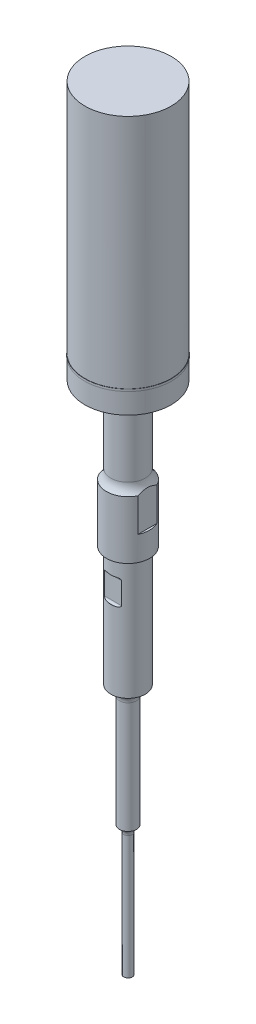
from build123d import *

# Parameters (mm, degrees)
CUT_EXTRUDE1_DEPTH      = 286.633670547
CUT_EXTRUDE1_DEPTH_BACK = 286.633670547
CUT_EXTRUDE2_DEPTH      = 286.633670547
CUT_EXTRUDE2_DEPTH_BACK = 286.633670547
SKETCH7_W               = 0.1
SKETCH7_H               = 0.8


with BuildPart() as part:
    # Sketch1 → Revolve1 (revolve)
    with BuildSketch(Plane.XY):
        with BuildLine():
            Line((0, 0), (15.875, 0))
            Line((15.875, 0), (15.875, -95.25))
            Line((15.875, -95.25), (7.75, -95.25))
            ThreePointArc((7.75, -95.25), (6.710108543, -97.13103799), (6.35, -99.25))
            Line((6.35, -99.25), (6.35, -123.35))
            ThreePointArc((6.35, -123.35), (6.765423592, -125.271598049), (7.9375, -126.85))
            Line((7.9375, -126.85), (7.9375, -148.15))
            Line((7.9375, -148.15), (6.35, -148.15))
            Line((6.35, -148.15), (6.35, -192.25))
            ThreePointArc((6.35, -192.25), (4.060973326, -193.504085038), (3.15, -195.95))
            Line((3.15, -195.95), (3.15, -236.95))
            ThreePointArc((3.15, -236.95), (2.021186638, -237.921495537), (1.6, -239.35))
            Line((1.6, -239.35), (1.6, -284.75))
            Line((1.6, -284.75), (0, -284.75))
            Line((0, -284.75), (0, 0))
        make_face()
    revolve(axis=Axis((0, -284.75, 0), (0, 1, 0)))

    # Sketch3 → Cut-Extrude1 (cut, two sides: drawn at the far end of the back side and taken through both)
    with BuildSketch(Plane.XY.offset(-CUT_EXTRUDE1_DEPTH_BACK)):
        with BuildLine():
            Line((7.9375, -139.15), (7.9375, -126.85))
            ThreePointArc((7.9375, -126.85), (7.511434792, -126.425239776), (7.14375, -125.949045798))
            Line((7.14375, -125.949045798), (7.14375, -139.15))
            Line((7.14375, -139.15), (7.9375, -139.15))
        make_face()
        with BuildLine():
            Line((-7.14375, -139.15), (-7.14375, -125.949045798))
            ThreePointArc((-7.14375, -125.949045798), (-7.511434792, -126.425239776), (-7.9375, -126.85))
            Line((-7.9375, -126.85), (-7.9375, -139.15))
            Line((-7.9375, -139.15), (-7.14375, -139.15))
        make_face()
    extrude(amount=CUT_EXTRUDE1_DEPTH + CUT_EXTRUDE1_DEPTH_BACK, mode=Mode.SUBTRACT)

    # Sketch4 → Cut-Extrude2 (cut, two sides: drawn at the far end of the back side and taken through both)
    with BuildSketch(Plane(origin=(0, 0, 0), x_dir=(0, 0, -1), z_dir=(1, 0, 0)).offset(-CUT_EXTRUDE2_DEPTH_BACK)):
        with BuildLine():
            Line((6.35, -163.5805), (6.2245, -163.5805))
            ThreePointArc((6.2245, -163.5805), (5.729525253, -163.375474747), (5.5245, -162.8805))
            Line((5.5245, -162.8805), (5.5245, -154.8825))
            ThreePointArc((5.5245, -154.8825), (5.729525253, -154.387525253), (6.2245, -154.1825))
            Line((6.2245, -154.1825), (6.35, -154.1825))
            Line((6.35, -154.1825), (6.35, -163.5805))
        make_face()
        with BuildLine():
            Line((-5.5245, -162.8805), (-5.5245, -154.8825))
            ThreePointArc((-5.5245, -154.8825), (-5.729525253, -154.387525253), (-6.2245, -154.1825))
            Line((-6.2245, -154.1825), (-6.35, -154.1825))
            Line((-6.35, -154.1825), (-6.35, -163.5805))
            Line((-6.35, -163.5805), (-6.2245, -163.5805))
            ThreePointArc((-6.2245, -163.5805), (-5.729525253, -163.375474747), (-5.5245, -162.8805))
        make_face()
    extrude(amount=CUT_EXTRUDE2_DEPTH + CUT_EXTRUDE2_DEPTH_BACK, mode=Mode.SUBTRACT)

    # Sketch7 → Dont Clamp Below (revolve)
    with BuildSketch(Plane.XY):
        with Locations((15.925, -87.25)):
            Rectangle(SKETCH7_W, SKETCH7_H)
    revolve(axis=Axis((0, -284.75, 0), (0, 1, 0)))


solid = part.part
